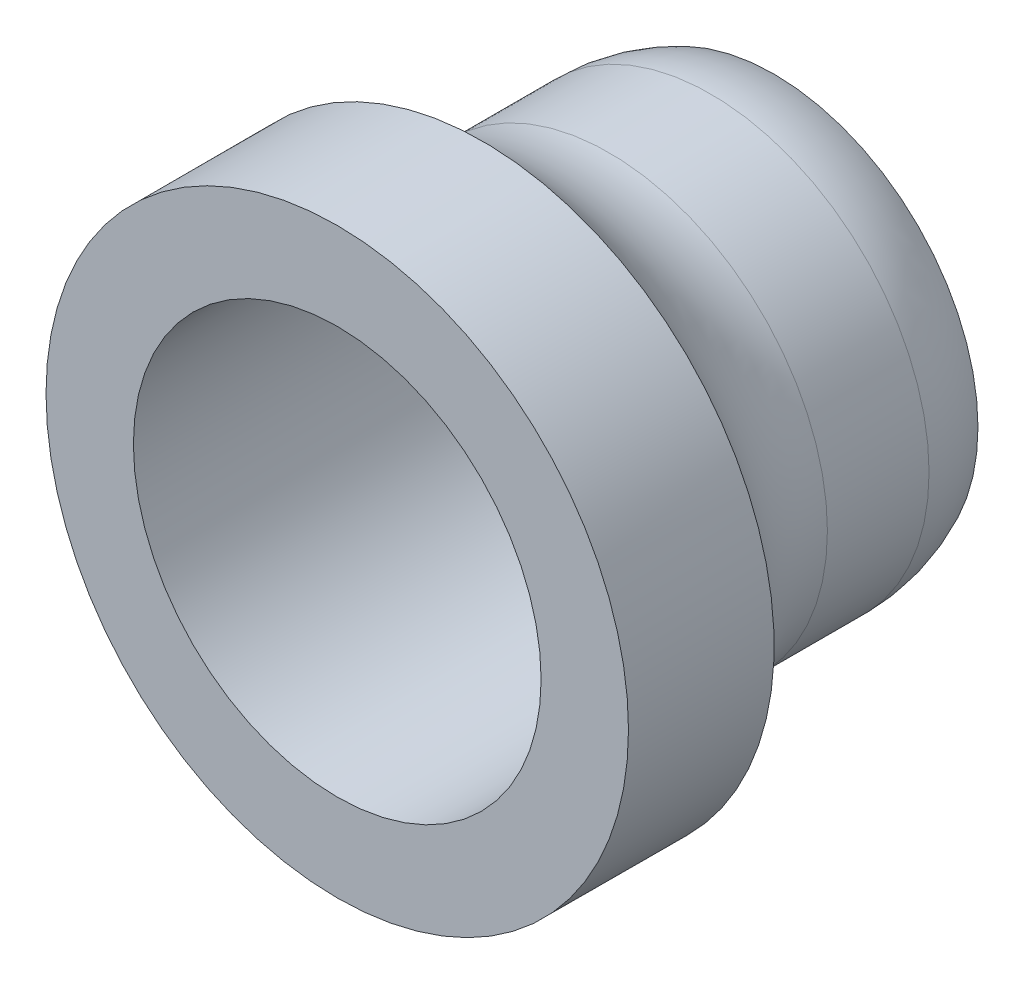
from build123d import *

# Parameters (mm, degrees)
SKETCH1_R           = 20
SKETCH1_R_2         = 14
BOSS_EXTRUDE1_DEPTH = 30
SKETCH2_R           = 20
SKETCH2_R_2         = 15
CUT_EXTRUDE1_DEPTH  = 20
FILLET1_R           = 10


with BuildPart() as part:
    # Sketch1 → Boss-Extrude1 (new body)
    with BuildSketch(Plane.XY):
        Circle(SKETCH1_R)
        Circle(SKETCH1_R_2, mode=Mode.SUBTRACT)
    extrude(amount=BOSS_EXTRUDE1_DEPTH)

    # Sketch2 → Cut-Extrude1 (cut)
    with BuildSketch(Plane(origin=(0, 0, 0), x_dir=(-1, 0, 0), z_dir=(0, 0, -1))):
        Circle(SKETCH2_R)
        Circle(SKETCH2_R_2, mode=Mode.SUBTRACT)
    extrude(amount=-CUT_EXTRUDE1_DEPTH, mode=Mode.SUBTRACT)

    # Fillet1
    # the kernel refuses this fillet: 10 mm, written as the material it adds along each edge
    with BuildSketch(Plane(origin=(0, 0, 20), x_dir=(-1, 0, 0), z_dir=(0, -1, 0))) as fillet1_piece_1:
        with BuildLine():
            CenterArc((25, 8.660254038), FILLET1_R, 180, 60)
            Line((20, 0), (19.9, -0.173205081))
            ThreePointArc((19.9, -0.173205081), (17.5, -0.2), (15, -0.2))
            Line((15, -0.2), (14.8, 0))
            Line((14.8, 0), (14.8, 8.660254038))
            Line((14.8, 8.660254038), (15, 8.660254038))
        make_face()
    revolve(axis=Axis((0, 0, 20), (0, 0, -1)))
    # the kernel refuses this fillet: 10 mm, written as the material it takes off along each edge
    with BuildSketch(Plane(origin=(0, 0, 0), x_dir=(-1, 0, 0), z_dir=(0, -1, 0))) as fillet1_2_piece_1:
        with BuildLine():
            CenterArc((5, -4.358898944), FILLET1_R, 0, 25.841932763)
            Line((14, 0), (14.18, 0.087177979))
            ThreePointArc((14.18, 0.087177979), (14.5, 0.2), (15, 0.2))
            Line((15, 0.2), (15.2, 0))
            Line((15.2, 0), (15.2, -4.358898944))
            Line((15.2, -4.358898944), (15, -4.358898944))
        make_face()
    revolve(axis=Axis((0, 0, 0), (0, 0, -1)), mode=Mode.SUBTRACT)


solid = part.part
